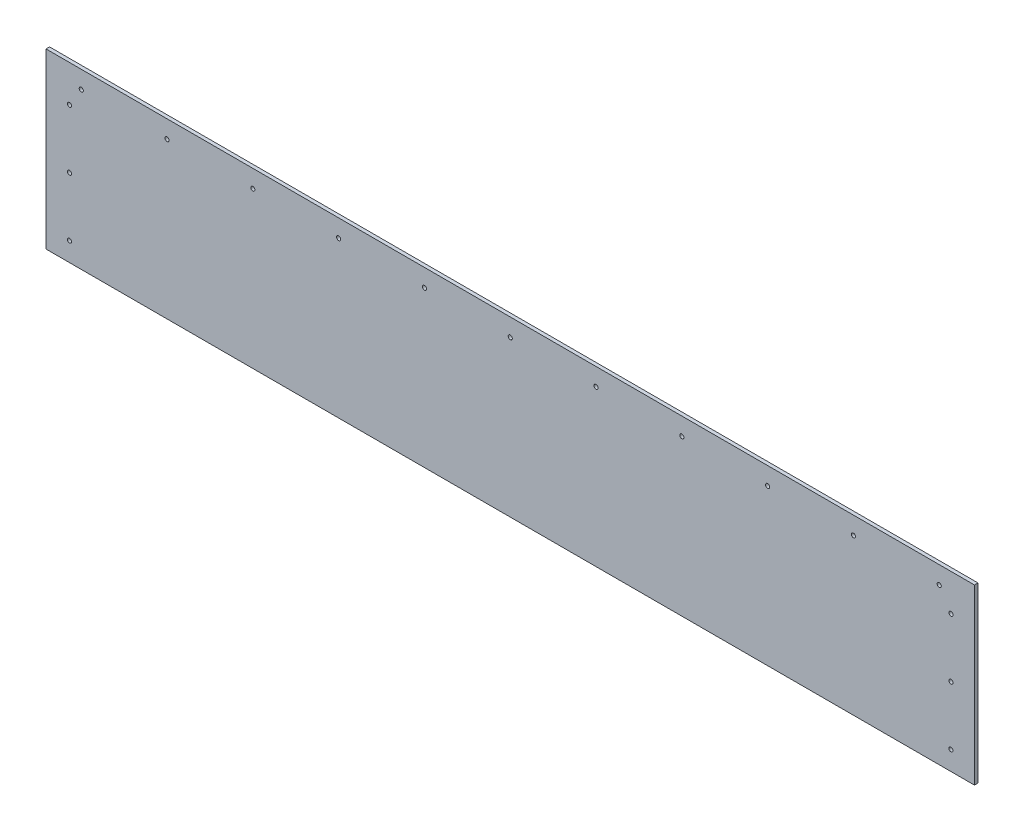
from build123d import *

# Parameters (mm, degrees)
BASE_FLANGE1_DEPTH      = 6
SKETCH6_W               = 1952.366883789
SKETCH6_H               = 635.232253026
CUT_EXTRUDE1_DEPTH      = 10
CUT_EXTRUDE2_DEPTH      = 10
SKETCH8_R               = 3.5
CUT_EXTRUDE3_DEPTH      = 10
LPATTERN1_COUNT         = 6
LPATTERN1_PITCH         = 146
LPATTERN1_COL_COUNT     = 6
LPATTERN1_COL_PITCH     = 146
SKETCH9_R               = 3.5
CUT_EXTRUDE4_DEPTH      = 10
LPATTERN2_COUNT         = 2
LPATTERN2_PITCH         = 100
LPATTERN2_COL_COUNT     = 2
LPATTERN2_COL_PITCH     = 100
MIRROR2_COPY_1_SKETCH_R = 3.5
MIRROR2_COPY_1_DEPTH    = 10
MIRROR2_COPY_2_SKETCH_R = 3.5
MIRROR2_COPY_2_DEPTH    = 10


# Sheet-metal steps are written as plain solids
with BuildPart() as part:
    # Sketch1 → Base-Flange1 (new body)
    with BuildSketch(Plane.XY):
        with BuildLine():
            Line((859.985464993, -5), (-859.985464993, -5))
            ThreePointArc((-859.985464993, -5), (0, -860), (859.985464993, -5))
        make_face()
    extrude(amount=-BASE_FLANGE1_DEPTH)

    # Sketch6 → Cut-Extrude1 (cut)
    with BuildSketch(Plane.XY):
        with Locations((-97.229426483, -617.616126513)):
            Rectangle(SKETCH6_W, SKETCH6_H)
    extrude(amount=-CUT_EXTRUDE1_DEPTH, mode=Mode.SUBTRACT)

    # Sketch7 → Cut-Extrude2 (cut)
    with BuildSketch(Plane.XY):
        with BuildLine():
            Line((-859.985464993, -5), (-789.985464993, -5))
            Line((-789.985464993, -5), (-789.985464993, -300))
            Line((-789.985464993, -300), (-805.977667184, -300))
            ThreePointArc((-805.977667184, -300), (-845.940033007, -154.872400886), (-859.985464993, -5))
        make_face()
    cut_extrude2 = extrude(amount=-CUT_EXTRUDE2_DEPTH, mode=Mode.SUBTRACT)

    # Mirror1: Cut-Extrude2 across plane
    add(cut_extrude2.mirror(Plane(origin=(0, 0, 0), x_dir=(0, 0, 1), z_dir=(1, 0, 0))), mode=Mode.SUBTRACT)

    # Sketch8 → Cut-Extrude3 (cut)
    with BuildSketch(Plane.XY):
        with Locations((0, -35)):
            Circle(SKETCH8_R)
    cut_extrude3 = extrude(amount=-CUT_EXTRUDE3_DEPTH, mode=Mode.SUBTRACT)

    # LPattern1: Cut-Extrude3 ×6
    with Locations(*[(-i * LPATTERN1_PITCH, 0, 0) for i in range(1, LPATTERN1_COUNT)]):
        add(cut_extrude3, mode=Mode.SUBTRACT)

    # LPattern1 col: Cut-Extrude3 ×6
    with Locations(*[(i * LPATTERN1_COL_PITCH, 0, 0) for i in range(1, LPATTERN1_COL_COUNT)]):
        add(cut_extrude3, mode=Mode.SUBTRACT)

    # Sketch9 → Cut-Extrude4 (cut)
    with BuildSketch(Plane(origin=(0, 0, -6), x_dir=(-1, 0, 0), z_dir=(0, 0, -1))):
        with Locations((-749.985464993, -167.5)):
            Circle(SKETCH9_R)
    cut_extrude4 = extrude(amount=-CUT_EXTRUDE4_DEPTH, mode=Mode.SUBTRACT)

    # LPattern2: Cut-Extrude4 ×2
    with Locations(*[(0, -i * LPATTERN2_PITCH, 0) for i in range(1, LPATTERN2_COUNT)]):
        add(cut_extrude4, mode=Mode.SUBTRACT)

    # LPattern2 col: Cut-Extrude4 ×2
    with Locations(*[(0, i * LPATTERN2_COL_PITCH, 0) for i in range(1, LPATTERN2_COL_COUNT)]):
        add(cut_extrude4, mode=Mode.SUBTRACT)

    # Mirror2: Cut-Extrude4 across plane
    add(cut_extrude4.mirror(Plane(origin=(0, 0, 0), x_dir=(0, 0, 1), z_dir=(1, 0, 0))), mode=Mode.SUBTRACT)

    # Mirror2 copy 1 sketch → Mirror2 copy 1 (cut)
    with BuildSketch(Plane(origin=(0, -100, -6), x_dir=(1, 0, 0), z_dir=(0, 0, -1))):
        with Locations((-749.985464993, 167.5)):
            Circle(MIRROR2_COPY_1_SKETCH_R)
    extrude(amount=-MIRROR2_COPY_1_DEPTH, mode=Mode.SUBTRACT)

    # Mirror2 copy 2 sketch → Mirror2 copy 2 (cut)
    with BuildSketch(Plane(origin=(0, 100, -6), x_dir=(1, 0, 0), z_dir=(0, 0, -1))):
        with Locations((-749.985464993, 167.5)):
            Circle(MIRROR2_COPY_2_SKETCH_R)
    extrude(amount=-MIRROR2_COPY_2_DEPTH, mode=Mode.SUBTRACT)


solid = part.part
